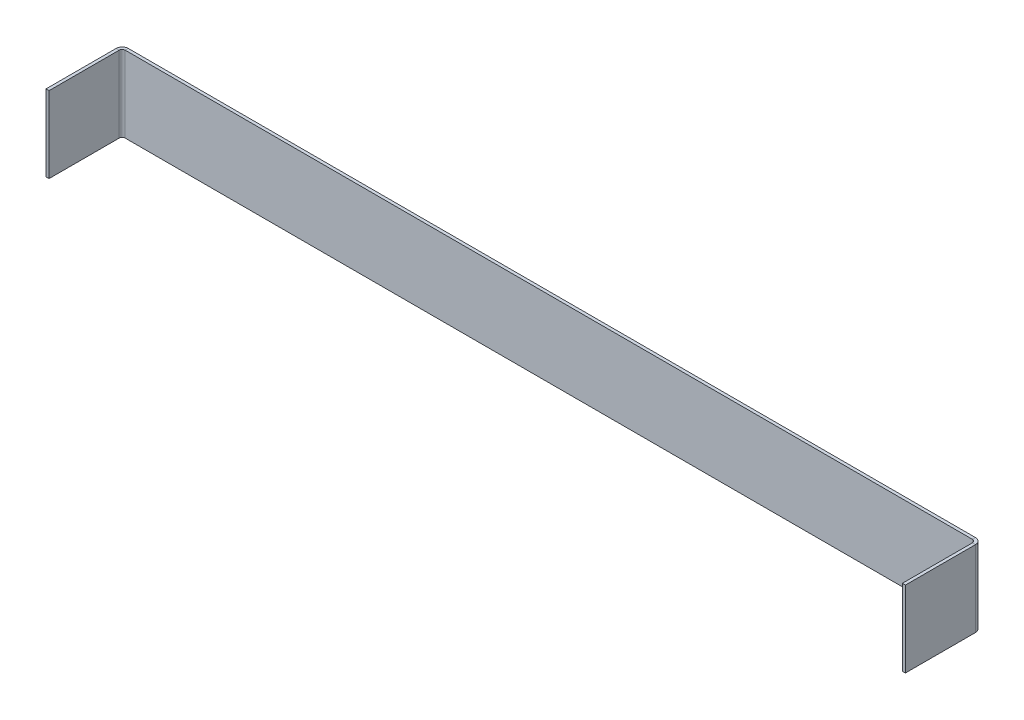
from build123d import *

# Parameters (mm, degrees)
SKETCH_1_W                       = 564
SKETCH_1_H                       = 50
SM_BASE_FLANGE_1_DEPTH           = 2
SM_EDGE_FLANGE_1_STRIP_W         = 12
SM_EDGE_FLANGE_1_STRIP_H         = 2
SM_EDGE_FLANGE_1_STRIP_CUT_DEPTH = 50
SM_EDGE_FLANGE_1_DEPTH           = 50
SM_EDGE_FLANGE_2_STRIP_W         = 12
SM_EDGE_FLANGE_2_STRIP_H         = 2
SM_EDGE_FLANGE_2_STRIP_CUT_DEPTH = 50
SM_EDGE_FLANGE_2_DEPTH           = 50


# Sheet-metal steps are written as plain solids
with BuildPart() as part:
    # Sketch 1 → Базовая кромка1 (new body)
    with BuildSketch(Plane.XY):
        with Locations((282, 25)):
            Rectangle(SKETCH_1_W, SKETCH_1_H)
    extrude(amount=SM_BASE_FLANGE_1_DEPTH)

    # Ребро-кромка1 strip (across the edge) → Ребро-кромка1 strip cut (cut)
    with BuildSketch(Plane(origin=(0, 50, 2), x_dir=(1, 0, 0), z_dir=(0, -1, 0))):
        with Locations((-2, -1)):
            Rectangle(SM_EDGE_FLANGE_1_STRIP_W, SM_EDGE_FLANGE_1_STRIP_H)
    extrude(amount=SM_EDGE_FLANGE_1_STRIP_CUT_DEPTH, mode=Mode.SUBTRACT)

    # Ребро-кромка1 section (across the edge) → Ребро-кромка1 (add)
    with BuildSketch(Plane(origin=(0, 50, 2), x_dir=(1, 0, 0), z_dir=(0, -1, 0))):
        with BuildLine():
            Line((0, 2), (0, 48))
            Line((0, 48), (2, 48))
            Line((2, 48), (2, 2))
            ThreePointArc((2, 2), (2.585786438, 0.585786438), (4, 0))
            Line((4, 0), (4, -2))
            ThreePointArc((4, -2), (1.171572875, -0.828427125), (0, 2))
        make_face()
    extrude(amount=SM_EDGE_FLANGE_1_DEPTH)

    # Ребро-кромка2 strip (across the edge) → Ребро-кромка2 strip cut (cut)
    with BuildSketch(Plane(origin=(564, 0, 2), x_dir=(-1, 0, 0), z_dir=(0, 1, 0))):
        with Locations((-2, -1)):
            Rectangle(SM_EDGE_FLANGE_2_STRIP_W, SM_EDGE_FLANGE_2_STRIP_H)
    extrude(amount=SM_EDGE_FLANGE_2_STRIP_CUT_DEPTH, mode=Mode.SUBTRACT)

    # Ребро-кромка2 section (across the edge) → Ребро-кромка2 (add)
    with BuildSketch(Plane(origin=(564, 0, 2), x_dir=(-1, 0, 0), z_dir=(0, 1, 0))):
        with BuildLine():
            Line((0, 2), (0, 48))
            Line((0, 48), (2, 48))
            Line((2, 48), (2, 2))
            ThreePointArc((2, 2), (2.585786438, 0.585786438), (4, 0))
            Line((4, 0), (4, -2))
            ThreePointArc((4, -2), (1.171572875, -0.828427125), (0, 2))
        make_face()
    extrude(amount=SM_EDGE_FLANGE_2_DEPTH)


solid = part.part
